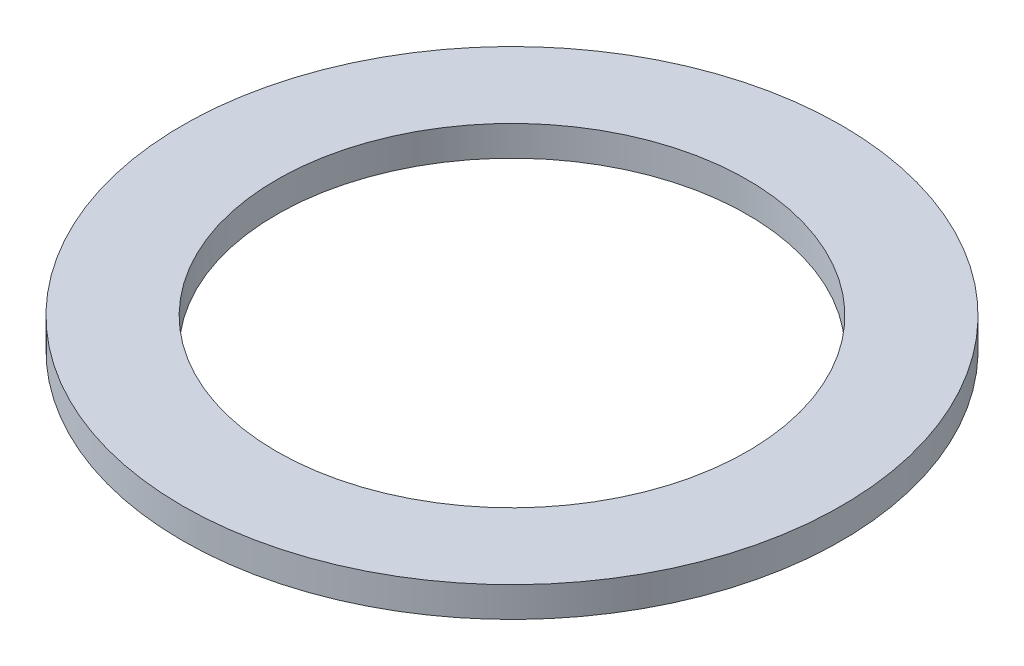
from build123d import *

# Parameters (mm, degrees)
SKETCH1_R           = 11.1125
SKETCH1_R_2         = 7.9375
BOSS_EXTRUDE1_DEPTH = 0.508


with BuildPart() as part:
    # Sketch1 → Boss-Extrude1 (new, symmetric)
    with BuildSketch(Plane(origin=(0, 0, 0), x_dir=(1, 0, 0), z_dir=(0, 1, 0))):
        Circle(SKETCH1_R)
        Circle(SKETCH1_R_2, mode=Mode.SUBTRACT)
    extrude(amount=BOSS_EXTRUDE1_DEPTH, both=True)


solid = part.part
